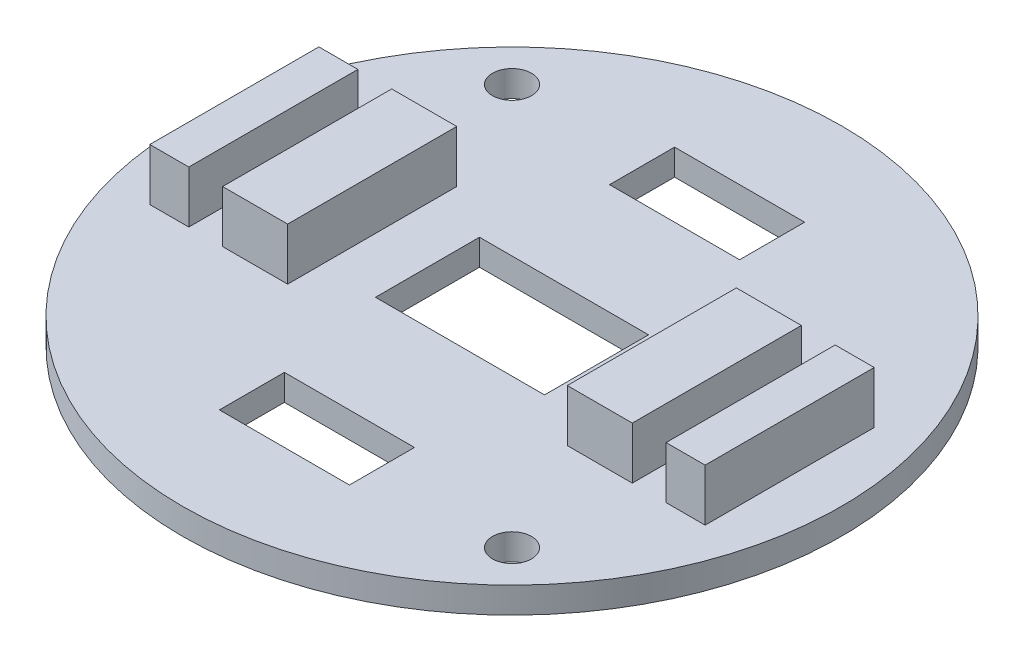
from build123d import *

# Parameters (mm, degrees)
SKETCH1_R           = 25.34
BOSS_EXTRUDE1_DEPTH = 2
SKETCH2_W           = 5
SKETCH2_H           = 13
SKETCH2_W_2         = 3
BOSS_EXTRUDE2_DEPTH = 4
SKETCH3_R           = 1.5
CUT_EXTRUDE1_DEPTH  = 37.058718779
SKETCH4_W           = 10
SKETCH4_H           = 5
SKETCH4_W_2         = 13
SKETCH4_H_2         = 8
CUT_EXTRUDE2_DEPTH  = 37.058718779


with BuildPart() as part:
    # Sketch1 → Boss-Extrude1 (new body)
    with BuildSketch(Plane(origin=(0, 0, 0), x_dir=(1, 0, 0), z_dir=(0, 1, 0))):
        Circle(SKETCH1_R)
    extrude(amount=BOSS_EXTRUDE1_DEPTH)

    # Sketch2 → Boss-Extrude2 (add)
    with BuildSketch(Plane(origin=(0, 2, 0), x_dir=(1, 0, 0), z_dir=(0, 1, 0))):
        with Locations((13.25, 0)):
            Rectangle(SKETCH2_W, SKETCH2_H)
        with Locations((19.85, 0)):
            Rectangle(SKETCH2_W_2, SKETCH2_H)
        with Locations((-19.85, 0)):
            Rectangle(SKETCH2_W_2, SKETCH2_H)
        with Locations((-13.25, 0)):
            Rectangle(SKETCH2_W, SKETCH2_H)
    extrude(amount=BOSS_EXTRUDE2_DEPTH)

    # Sketch3 → Cut-Extrude1 (cut, through all)
    with BuildSketch(Plane(origin=(0, 2, 0), x_dir=(1, 0, 0), z_dir=(0, 1, 0))):
        with Locations((-15.421998898, 15.421998898)):
            Circle(SKETCH3_R)
        with Locations((15.421998898, -15.421998898)):
            Circle(SKETCH3_R)
    extrude(amount=-CUT_EXTRUDE1_DEPTH, mode=Mode.SUBTRACT)

    # Sketch4 → Cut-Extrude2 (cut, through all)
    with BuildSketch(Plane(origin=(0, 2, 0), x_dir=(1, 0, 0), z_dir=(0, 1, 0))):
        with Locations((0, 15)):
            Rectangle(SKETCH4_W, SKETCH4_H)
        with Locations((0, -15)):
            Rectangle(SKETCH4_W, SKETCH4_H)
        Rectangle(SKETCH4_W_2, SKETCH4_H_2)
    extrude(amount=-CUT_EXTRUDE2_DEPTH, mode=Mode.SUBTRACT)


solid = part.part
